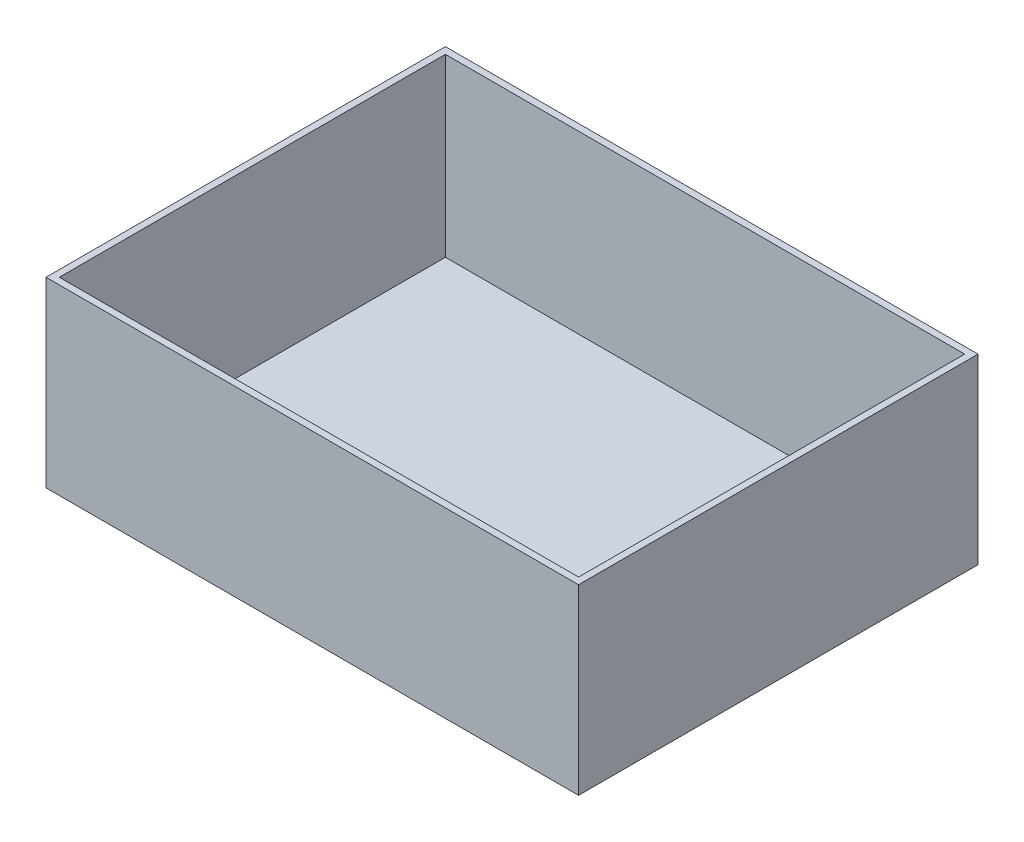
from build123d import *

# Parameters (mm, degrees)
SKETCH1_W           = 200
SKETCH1_H           = 150
BOSS_EXTRUDE1_DEPTH = 68.5
SKETCH2_W           = 195
SKETCH2_H           = 145
CUT_EXTRUDE1_DEPTH  = 66


with BuildPart() as part:
    # Sketch1 → Boss-Extrude1 (new body)
    with BuildSketch(Plane(origin=(0, 0, 0), x_dir=(1, 0, 0), z_dir=(0, 1, 0))):
        Rectangle(SKETCH1_W, SKETCH1_H)
    extrude(amount=BOSS_EXTRUDE1_DEPTH)

    # Sketch2 → Cut-Extrude1 (cut)
    with BuildSketch(Plane(origin=(0, 68.5, 0), x_dir=(1, 0, 0), z_dir=(0, 1, 0))):
        Rectangle(SKETCH2_W, SKETCH2_H)
    extrude(amount=-CUT_EXTRUDE1_DEPTH, mode=Mode.SUBTRACT)


solid = part.part
